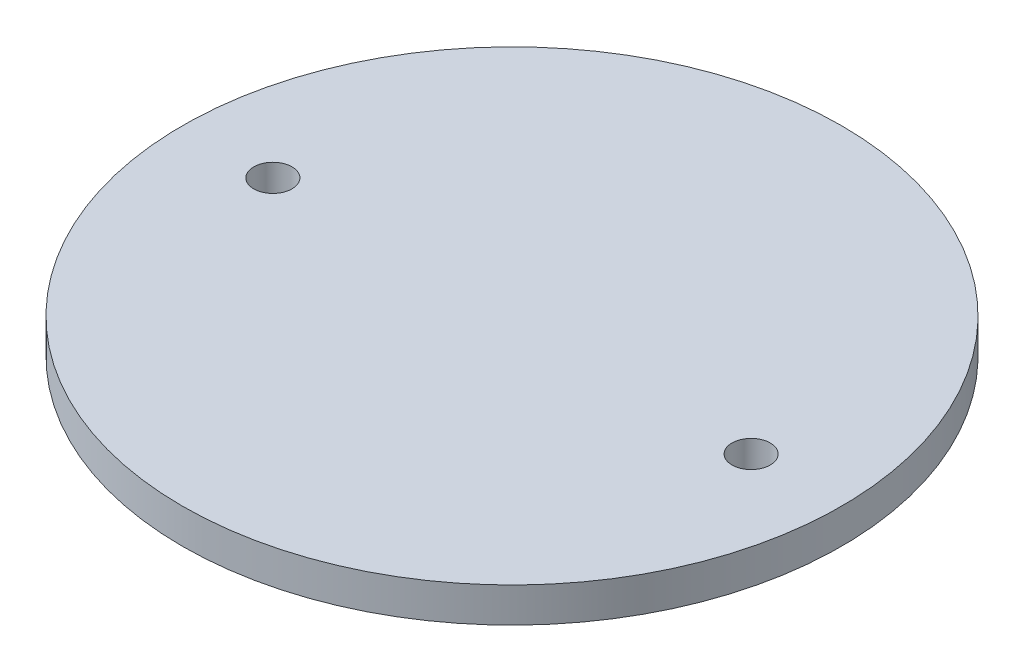
from build123d import *

# Parameters (mm, degrees)
SKETCH1_R           = 37.9
SKETCH1_R_2         = 2.2
BOSS_EXTRUDE1_DEPTH = 4


with BuildPart() as part:
    # Sketch1 → Boss-Extrude1 (new body)
    with BuildSketch(Plane(origin=(0, 0, 0), x_dir=(1, 0, 0), z_dir=(0, 1, 0))):
        Circle(SKETCH1_R)
        with Locations((-27.5, 0)):
            Circle(SKETCH1_R_2, mode=Mode.SUBTRACT)
        with Locations((27.5, 0)):
            Circle(SKETCH1_R_2, mode=Mode.SUBTRACT)
    extrude(amount=BOSS_EXTRUDE1_DEPTH)


solid = part.part
